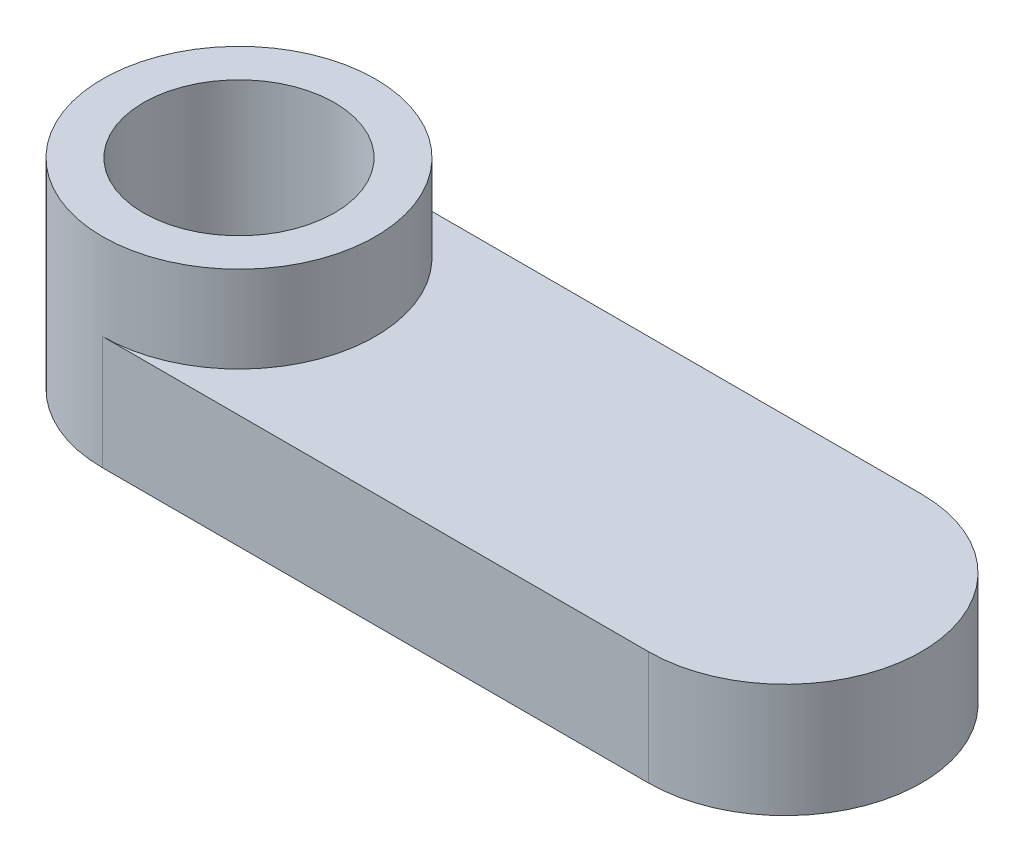
from build123d import *

# Parameters (mm, degrees)
EXTRUDE_2_DEPTH = 2.5
SKETCH_1_4_R    = 2.1
EXTRUDE_3_DEPTH = 4.4


with BuildPart() as part:
    # 草图1 → 凸台-拉伸2 (new body)
    with BuildSketch(Plane(origin=(0, 0, 0), x_dir=(1, 0, 0), z_dir=(0, 1, 0))):
        with BuildLine():
            Line((12, 3), (0, 3))
            ThreePointArc((0, 3), (2.121320344, 2.121320344), (3, 0))
            ThreePointArc((3, 0), (2.121320344, -2.121320344), (0, -3))
            Line((0, -3), (12, -3))
            ThreePointArc((12, -3), (15, 0), (12, 3))
        make_face()
    extrude(amount=EXTRUDE_2_DEPTH)

    # 草图1<4> → 凸台-拉伸3 (add)
    with BuildSketch(Plane(origin=(0, 0, 0), x_dir=(1, 0, 0), z_dir=(0, 1, 0))):
        with BuildLine():
            ThreePointArc((3, 0), (2.121320344, 2.121320344), (0, 3))
            ThreePointArc((0, 3), (-3, 0), (0, -3))
            ThreePointArc((0, -3), (2.121320344, -2.121320344), (3, 0))
        make_face()
        Circle(SKETCH_1_4_R, mode=Mode.SUBTRACT)
    extrude(amount=EXTRUDE_3_DEPTH)


solid = part.part
